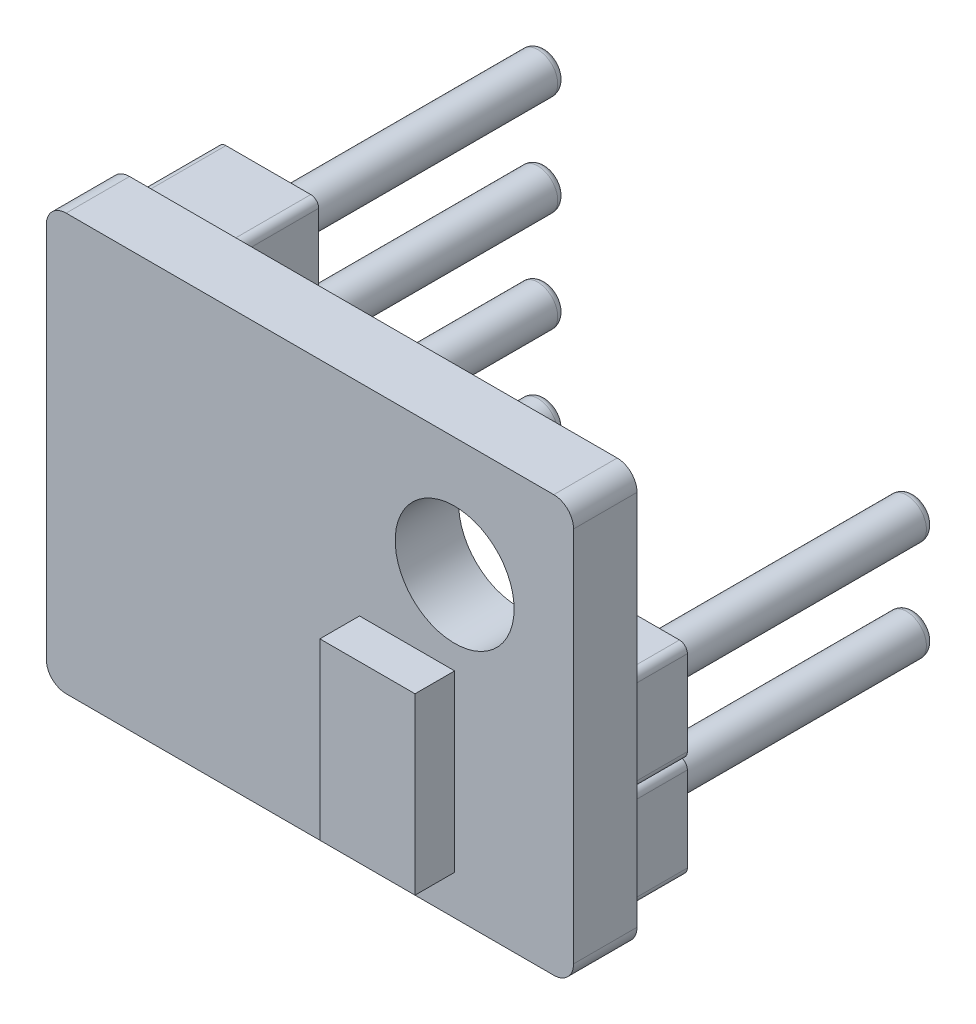
from build123d import *

# Parameters (mm, degrees)
SKETCH1_W           = 13.3
SKETCH1_H           = 10.5
BOSS_EXTRUDE1_DEPTH = 1.6
SKETCH2_R           = 1.5
CUT_EXTRUDE1_DEPTH  = 1.6
SKETCH3_W           = 2.4
SKETCH3_H           = 4.4
BOSS_EXTRUDE2_DEPTH = 1
FILLET1_R           = 0.5
SKETCH4_W           = 2.54
SKETCH4_H           = 2.54
BOSS_EXTRUDE3_DEPTH = 2
SKETCH5_R           = 0.5
BOSS_EXTRUDE4_DEPTH = 7
FILLET2_R           = 0.2
LPATTERN1_START     = -2
LPATTERN1_DEPTH     = 2
SKETCH6_W           = 2.54
SKETCH6_H           = 2.54
BOSS_EXTRUDE5_DEPTH = 2
SKETCH7_R           = 0.5
BOSS_EXTRUDE6_DEPTH = 7
FILLET3_R           = 0.2
LPATTERN2_START     = -2
LPATTERN2_DEPTH     = 2


# Read off the part's stored shape, not the designer's step: LPattern1, LPattern2
with BuildPart() as part:
    # Sketch1 → Boss-Extrude1 (new body)
    with BuildSketch(Plane.XY):
        Rectangle(SKETCH1_W, SKETCH1_H)
    extrude(amount=BOSS_EXTRUDE1_DEPTH)

    # Sketch2 → Cut-Extrude1 (cut)
    with BuildSketch(Plane.XY.offset(1.6)):
        with Locations((3.65, 2.25)):
            Circle(SKETCH2_R)
    extrude(amount=-CUT_EXTRUDE1_DEPTH, mode=Mode.SUBTRACT)

    # Sketch3 → Boss-Extrude2 (add)
    with BuildSketch(Plane.XY.offset(1.6)):
        with Locations((2.45, -2.05)):
            Rectangle(SKETCH3_W, SKETCH3_H)
    extrude(amount=BOSS_EXTRUDE2_DEPTH)

    # Fillet1
    fillet1_edges = [part.edges().sort_by_distance(p)[0] for p in [
        (-6.65, 5.25, 0.8),
        (6.65, 5.25, 0.8),
        (6.65, -5.25, 0.8),
        (-6.65, -5.25, 0.8),
    ]]
    fillet(fillet1_edges, radius=FILLET1_R)

    # Sketch4 → Boss-Extrude3 (add)
    with BuildSketch(Plane(origin=(0, 0, 0), x_dir=(-1, 0, 0), z_dir=(0, 0, -1))):
        with Locations((4.65, -3.75)):
            Rectangle(SKETCH4_W, SKETCH4_H)
    extrude(amount=BOSS_EXTRUDE3_DEPTH)

    # Sketch5 → Boss-Extrude4 (add)
    with BuildSketch(Plane(origin=(0, 0, -2), x_dir=(-1, 0, 0), z_dir=(0, 0, -1))):
        with Locations((4.65, -3.75)):
            Circle(SKETCH5_R)
    extrude(amount=BOSS_EXTRUDE4_DEPTH)

    # Fillet2
    fillet2_edges = [part.edges().sort_by_distance(p)[0] for p in [
        (-3.38, -2.48, -1),
        (-3.38, -5.02, -1),
        (-5.92, -5.02, -1),
        (-5.92, -2.48, -1),
        (-4.15, -3.75, -9),
    ]]
    fillet(fillet2_edges, radius=FILLET2_R)

    # LPattern1 outline → LPattern1 (add)
    with BuildSketch(Plane.XY.offset(LPATTERN1_START)):
        with BuildLine():
            Line((-3.38, -2.28), (-3.38, -0.14))
            ThreePointArc((-3.38, -0.14), (-3.438578644, 0.001421356), (-3.58, 0.06))
            ThreePointArc((-3.58, 0.06), (-3.438578644, 0.118578644), (-3.38, 0.26))
            Line((-3.38, 0.26), (-3.38, 2.4))
            ThreePointArc((-3.38, 2.4), (-3.438578644, 2.541421356), (-3.58, 2.6))
            ThreePointArc((-3.58, 2.6), (-3.438578644, 2.658578644), (-3.38, 2.8))
            Line((-3.38, 2.8), (-3.38, 4.94))
            ThreePointArc((-3.38, 4.94), (-3.438578644, 5.081421356), (-3.58, 5.14))
            Line((-3.58, 5.14), (-5.72, 5.14))
            ThreePointArc((-5.72, 5.14), (-5.861421356, 5.081421356), (-5.92, 4.94))
            Line((-5.92, 4.94), (-5.92, 2.8))
            ThreePointArc((-5.92, 2.8), (-5.861421356, 2.658578644), (-5.72, 2.6))
            ThreePointArc((-5.72, 2.6), (-5.861421356, 2.541421356), (-5.92, 2.4))
            Line((-5.92, 2.4), (-5.92, 0.26))
            ThreePointArc((-5.92, 0.26), (-5.861421356, 0.118578644), (-5.72, 0.06))
            ThreePointArc((-5.72, 0.06), (-5.861421356, 0.001421356), (-5.92, -0.14))
            Line((-5.92, -0.14), (-5.92, -2.28))
            ThreePointArc((-5.92, -2.28), (-5.861421356, -2.421421356), (-5.72, -2.48))
            Line((-5.72, -2.48), (-3.58, -2.48))
            ThreePointArc((-3.58, -2.48), (-3.438578644, -2.421421356), (-3.38, -2.28))
        make_face()
    extrude(amount=LPATTERN1_DEPTH)

    # LPattern1 2 outline → LPattern1 2 (revolve)
    with BuildSketch(Plane(origin=(-4.65, -1.21, 0), x_dir=(1, 0, 0), z_dir=(0, -1, 0))):
        with BuildLine():
            Line((0, -2), (0, -9))
            Line((0, -9), (0.3, -9))
            ThreePointArc((0.3, -9), (0.441421356, -8.941421356), (0.5, -8.8))
            Line((0.5, -8.8), (0.5, -2))
            Line((0.5, -2), (0, -2))
        make_face()
    revolve(axis=Axis((-4.65, -1.21, 0), (0, 0, 1)))

    # LPattern1 3 outline → LPattern1 3 (revolve)
    with BuildSketch(Plane(origin=(-4.65, 1.33, 0), x_dir=(1, 0, 0), z_dir=(0, -1, 0))):
        with BuildLine():
            Line((0, -2), (0, -9))
            Line((0, -9), (0.3, -9))
            ThreePointArc((0.3, -9), (0.441421356, -8.941421356), (0.5, -8.8))
            Line((0.5, -8.8), (0.5, -2))
            Line((0.5, -2), (0, -2))
        make_face()
    revolve(axis=Axis((-4.65, 1.33, 0), (0, 0, 1)))

    # LPattern1 4 outline → LPattern1 4 (revolve)
    with BuildSketch(Plane(origin=(-4.65, 3.87, 0), x_dir=(1, 0, 0), z_dir=(0, -1, 0))):
        with BuildLine():
            Line((0, -2), (0, -9))
            Line((0, -9), (0.3, -9))
            ThreePointArc((0.3, -9), (0.441421356, -8.941421356), (0.5, -8.8))
            Line((0.5, -8.8), (0.5, -2))
            Line((0.5, -2), (0, -2))
        make_face()
    revolve(axis=Axis((-4.65, 3.87, 0), (0, 0, 1)))

    # Sketch6 → Boss-Extrude5 (add)
    with BuildSketch(Plane(origin=(0, 0, 0), x_dir=(-1, 0, 0), z_dir=(0, 0, -1))):
        with Locations((-4.65, -3.75)):
            Rectangle(SKETCH6_W, SKETCH6_H)
    extrude(amount=BOSS_EXTRUDE5_DEPTH)

    # Sketch7 → Boss-Extrude6 (add)
    with BuildSketch(Plane(origin=(0, 0, -2), x_dir=(-1, 0, 0), z_dir=(0, 0, -1))):
        with Locations((-4.65, -3.75)):
            Circle(SKETCH7_R)
    extrude(amount=BOSS_EXTRUDE6_DEPTH)

    # Fillet3
    fillet3_edges = [part.edges().sort_by_distance(p)[0] for p in [
        (3.38, -5.02, -1),
        (3.38, -2.48, -1),
        (5.92, -2.48, -1),
        (5.92, -5.02, -1),
        (5.15, -3.75, -9),
    ]]
    fillet(fillet3_edges, radius=FILLET3_R)

    # LPattern2 outline → LPattern2 (add)
    with BuildSketch(Plane.XY.offset(LPATTERN2_START)):
        with BuildLine():
            Line((3.38, -0.14), (3.38, -2.28))
            ThreePointArc((3.38, -2.28), (3.438578644, -2.421421356), (3.58, -2.48))
            Line((3.58, -2.48), (5.72, -2.48))
            ThreePointArc((5.72, -2.48), (5.861421356, -2.421421356), (5.92, -2.28))
            Line((5.92, -2.28), (5.92, -0.14))
            ThreePointArc((5.92, -0.14), (5.861421356, 0.001421356), (5.72, 0.06))
            Line((5.72, 0.06), (3.58, 0.06))
            ThreePointArc((3.58, 0.06), (3.438578644, 0.001421356), (3.38, -0.14))
        make_face()
    extrude(amount=LPATTERN2_DEPTH)

    # LPattern2 2 outline → LPattern2 2 (revolve)
    with BuildSketch(Plane(origin=(4.65, -1.21, 0), x_dir=(1, 0, 0), z_dir=(0, -1, 0))):
        with BuildLine():
            Line((0, -2), (0, -9))
            Line((0, -9), (0.3, -9))
            ThreePointArc((0.3, -9), (0.441421356, -8.941421356), (0.5, -8.8))
            Line((0.5, -8.8), (0.5, -2))
            Line((0.5, -2), (0, -2))
        make_face()
    revolve(axis=Axis((4.65, -1.21, 0), (0, 0, 1)))


solid = part.part
